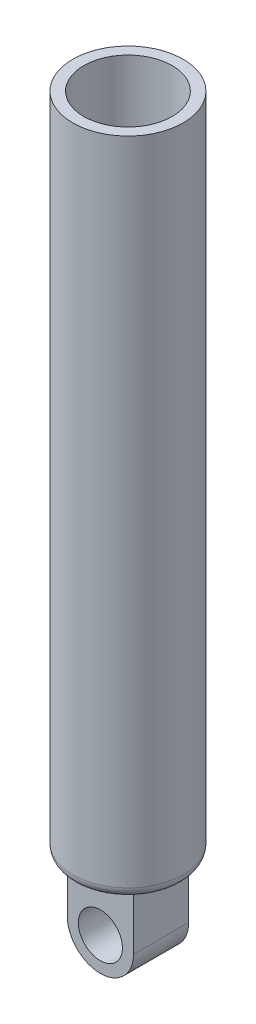
from build123d import *

# Parameters (mm, degrees)
SKETCH1_R           = 25
BOSS_EXTRUDE1_DEPTH = 300
SHELL1_T            = -5
FILLET1_R           = 5
SKETCH2_W           = 30
SKETCH2_H           = 25
BOSS_EXTRUDE2_DEPTH = 40
SKETCH3_R           = 10
CUT_EXTRUDE1_DEPTH  = 40
FILLET3_R           = 15


with BuildPart() as part:
    # Sketch1 → Boss-Extrude1 (new body)
    with BuildSketch(Plane(origin=(0, 0, 0), x_dir=(1, 0, 0), z_dir=(0, 1, 0))):
        with Locations(Location((0, 0, 0), (0, 0, 270))):
            Circle(SKETCH1_R)
    extrude(amount=BOSS_EXTRUDE1_DEPTH)

    # Shell1
    shell1_openings = [part.faces().sort_by_distance(p)[0] for p in [
        (0, 300, 0),
    ]]
    offset(amount=SHELL1_T, openings=shell1_openings, kind=Kind.INTERSECTION)

    # Fillet1
    fillet1_edges = [part.edges().sort_by_distance(p)[0] for p in [
        (0, 0, -25),
    ]]
    fillet(fillet1_edges, radius=FILLET1_R)

    # Sketch2 → Boss-Extrude2 (add)
    with BuildSketch(Plane.XZ):
        Rectangle(SKETCH2_W, SKETCH2_H)
    extrude(amount=BOSS_EXTRUDE2_DEPTH)

    # Sketch3 → Cut-Extrude1 (cut)
    with BuildSketch(Plane(origin=(0, 0, -12.5), x_dir=(-1, 0, 0), z_dir=(0, 0, -1))):
        with Locations((0, -25)):
            Circle(SKETCH3_R)
    extrude(amount=-CUT_EXTRUDE1_DEPTH, mode=Mode.SUBTRACT)

    # Fillet3
    fillet3_edges = [part.edges().sort_by_distance(p)[0] for p in [
        (-15, -40, 0),
        (15, -40, 0),
    ]]
    fillet(fillet3_edges, radius=FILLET3_R - 0.0001)  # a hair under: the kernel refuses the full size


solid = part.part
